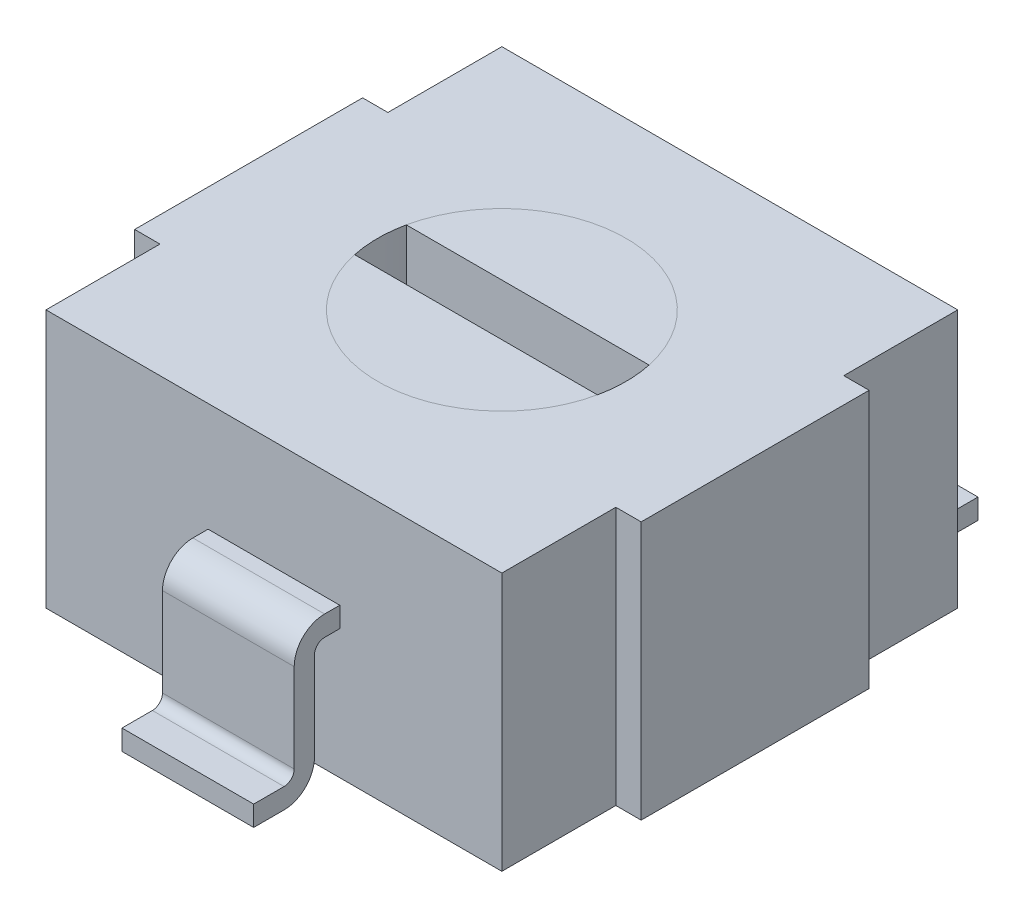
from build123d import *

# Parameters (mm, degrees)
SKETCH1_W                                      = 4.5
SKETCH1_H                                      = 4.5
BASE_EXTRUDE_DEPTH                             = 2.55
SKETCH2_W                                      = 0.25
SKETCH2_H                                      = 2.25
EARS_EXTRUDE1_DEPTH                            = 2.55
DOUBLE_START                                   = -1.6
DOUBLE_FEET_EXTRUDE_THIN1_DEPTH                = 3.2
SINGLE_START                                   = -0.65
SINGLE_FOOT_EXTRUDE_THIN2_DEPTH                = 1.3
SKETCH5_W                                      = 1.6
SKETCH5_H                                      = 0.85
REMOVE_MIDDLE_OF_THE_DOUBLE_PINS_EXTRUDE_DEPTH = 5.728900506
SCREW_DRIVER_SLOT_EXTRUDE2_DEPTH               = 0.51


# Read off the part's stored shape, not the designer's step: double feet-Extrude-Thin1, single foot-Extrude-Thin2
with BuildPart() as part:
    # Sketch1 → Base-Extrude (new body)
    with BuildSketch(Plane(origin=(0, 0, 0), x_dir=(1, 0, 0), z_dir=(0, 1, 0))):
        Rectangle(SKETCH1_W, SKETCH1_H)
    extrude(amount=BASE_EXTRUDE_DEPTH)

    # Sketch2 → ears-Extrude1 (add, through all)
    with BuildSketch(Plane(origin=(0, 2.55, 0), x_dir=(-1, 0, 0), z_dir=(0, 1, 0))):
        with Locations((-2.375, 0)):
            Rectangle(SKETCH2_W, SKETCH2_H)
        with Locations((2.375, 0)):
            Rectangle(SKETCH2_W, SKETCH2_H)
    extrude(amount=-EARS_EXTRUDE1_DEPTH)

    # double feet-Extrude-Thin1 outline → double feet-Extrude-Thin1 (add)
    with BuildSketch(Plane(origin=(0, 0, 0), x_dir=(0, 0, -1), z_dir=(1, 0, 0)).offset(DOUBLE_START)):
        with BuildLine():
            ThreePointArc((2.5, 0.3), (2.587867966, 0.087867966), (2.8, 0))
            Line((2.8, 0), (3.1, 0))
            Line((3.1, 0), (3.1, 0.2))
            Line((3.1, 0.2), (2.8, 0.2))
            ThreePointArc((2.8, 0.2), (2.729289322, 0.229289322), (2.7, 0.3))
            Line((2.7, 0.3), (2.7, 1.175))
            ThreePointArc((2.7, 1.175), (2.612132034, 1.387132034), (2.4, 1.475))
            Line((2.4, 1.475), (2.25, 1.475))
            Line((2.25, 1.475), (2.25, 1.275))
            Line((2.25, 1.275), (2.4, 1.275))
            ThreePointArc((2.4, 1.275), (2.470710678, 1.245710678), (2.5, 1.175))
            Line((2.5, 1.175), (2.5, 0.3))
        make_face()
    extrude(amount=DOUBLE_FEET_EXTRUDE_THIN1_DEPTH)

    # single foot-Extrude-Thin2 outline → single foot-Extrude-Thin2 (add)
    with BuildSketch(Plane(origin=(0, 0, 0), x_dir=(0, 0, -1), z_dir=(1, 0, 0)).offset(SINGLE_START)):
        with BuildLine():
            Line((-3.1, 0), (-2.8, 0))
            ThreePointArc((-2.8, 0), (-2.587867966, 0.087867966), (-2.5, 0.3))
            Line((-2.5, 0.3), (-2.5, 1.175))
            ThreePointArc((-2.5, 1.175), (-2.470710678, 1.245710678), (-2.4, 1.275))
            Line((-2.4, 1.275), (-2.25, 1.275))
            Line((-2.25, 1.275), (-2.25, 1.475))
            Line((-2.25, 1.475), (-2.4, 1.475))
            ThreePointArc((-2.4, 1.475), (-2.612132034, 1.387132034), (-2.7, 1.175))
            Line((-2.7, 1.175), (-2.7, 0.3))
            ThreePointArc((-2.7, 0.3), (-2.729289322, 0.229289322), (-2.8, 0.2))
            Line((-2.8, 0.2), (-3.1, 0.2))
            Line((-3.1, 0.2), (-3.1, 0))
        make_face()
    extrude(amount=SINGLE_FOOT_EXTRUDE_THIN2_DEPTH)

    # Sketch5 → remove middle of the double pins-Extrude1 (cut, through all)
    with BuildSketch(Plane(origin=(0, 2.55, 0), x_dir=(-1, 0, 0), z_dir=(0, 1, 0))):
        with Locations((0, -2.675)):
            Rectangle(SKETCH5_W, SKETCH5_H)
    extrude(amount=-REMOVE_MIDDLE_OF_THE_DOUBLE_PINS_EXTRUDE_DEPTH, mode=Mode.SUBTRACT)

    # Sketch7 → screw driver slot-Extrude2 (cut)
    with BuildSketch(Plane(origin=(0, 2.55, 0), x_dir=(-1, 0, 0), z_dir=(0, 1, 0))):
        with BuildLine():
            Line((-1.198165264, 0.255), (1.198165264, 0.255))
            ThreePointArc((1.198165264, 0.255), (1.225, 0), (1.198165264, -0.255))
            Line((1.198165264, -0.255), (-1.198165264, -0.255))
            ThreePointArc((-1.198165264, -0.255), (-1.225, 0), (-1.198165264, 0.255))
        make_face()
    extrude(amount=-SCREW_DRIVER_SLOT_EXTRUDE2_DEPTH, mode=Mode.SUBTRACT)


solid = part.part
